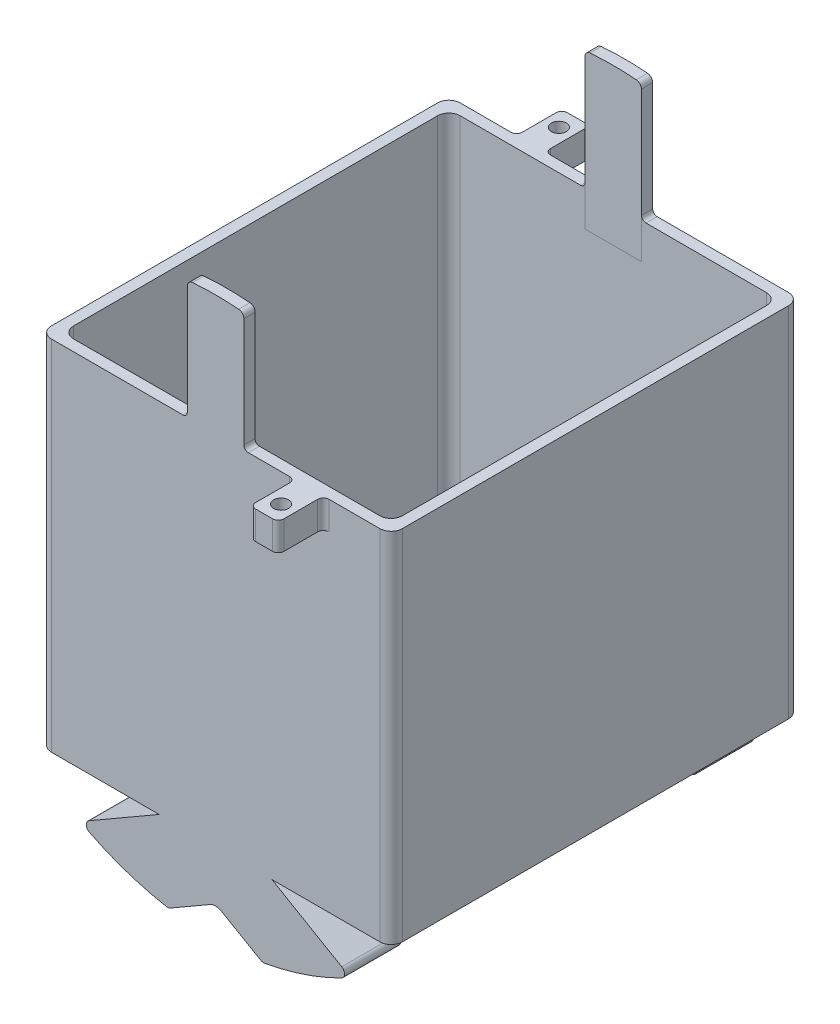
from build123d import *

# Parameters (mm, degrees)
BOSS_EXTRUDE1_DEPTH = 70
CUT_EXTRUDE1_DEPTH  = 79.756
BOSS_EXTRUDE3_DEPTH = 2.54
BOSS_EXTRUDE4_DEPTH = 2.54
BOSS_EXTRUDE5_DEPTH = 12.7
BOSS_EXTRUDE6_START = -2.54
BOSS_EXTRUDE6_DEPTH = 2.54
BOSS_EXTRUDE7_START = -12.7
BOSS_EXTRUDE7_DEPTH = 12.7
BOSS_EXTRUDE8_START = 8
BOSS_EXTRUDE8_DEPTH = 8
SKETCH9_R           = 1.685173155
BOSS_EXTRUDE9_DEPTH = 6.35
FILLET1_R           = 1.27
FILLET3_R           = 1


with BuildPart() as part:
    # Sketch1 → Boss-Extrude1 (new body)
    with BuildSketch(Plane(origin=(0, 0, 0), x_dir=(1, 0, 0), z_dir=(0, 1, 0))):
        with BuildLine():
            Line((-36.96, -46), (36.96, -46))
            ThreePointArc((36.96, -46), (38.756051224, -45.256051224), (39.5, -43.46))
            Line((39.5, -43.46), (39.5, 43.46))
            ThreePointArc((39.5, 43.46), (38.756051224, 45.256051224), (36.96, 46))
            Line((36.96, 46), (-36.96, 46))
            ThreePointArc((-36.96, 46), (-38.756051224, 45.256051224), (-39.5, 43.46))
            Line((-39.5, 43.46), (-39.5, -43.46))
            ThreePointArc((-39.5, -43.46), (-38.756051224, -45.256051224), (-36.96, -46))
        make_face()
    extrude(amount=-BOSS_EXTRUDE1_DEPTH)

    # Sketch2 → Cut-Extrude1 (cut)
    with BuildSketch(Plane(origin=(0, 0, 0), x_dir=(1, 0, 0), z_dir=(0, 1, 0))):
        with BuildLine():
            Line((-34.46, -43.5), (34.46, -43.5))
            ThreePointArc((34.46, -43.5), (36.256051224, -42.756051224), (37, -40.96))
            Line((37, -40.96), (37, 40.96))
            ThreePointArc((37, 40.96), (36.256051224, 42.756051224), (34.46, 43.5))
            Line((34.46, 43.5), (-34.46, 43.5))
            ThreePointArc((-34.46, 43.5), (-36.256051224, 42.756051224), (-37, 40.96))
            Line((-37, 40.96), (-37, -40.96))
            ThreePointArc((-37, -40.96), (-36.256051224, -42.756051224), (-34.46, -43.5))
        make_face()
    extrude(amount=-CUT_EXTRUDE1_DEPTH, mode=Mode.SUBTRACT)

    # Sketch4 → Boss-Extrude3 (add)
    with BuildSketch(Plane.XZ.offset(70)):
        with BuildLine():
            Line((36.96, 46), (-36.96, 46))
            ThreePointArc((-36.96, 46), (-38.756051224, 45.256051224), (-39.5, 43.46))
            Line((-39.5, 43.46), (-39.5, -43.46))
            ThreePointArc((-39.5, -43.46), (-38.756051224, -45.256051224), (-36.96, -46))
            Line((-36.96, -46), (36.96, -46))
            ThreePointArc((36.96, -46), (38.756051224, -45.256051224), (39.5, -43.46))
            Line((39.5, -43.46), (39.5, 43.46))
            ThreePointArc((39.5, 43.46), (38.756051224, 45.256051224), (36.96, 46))
        make_face()
    extrude(amount=BOSS_EXTRUDE3_DEPTH)

    # Sketch5 → Boss-Extrude4 (add)
    with BuildSketch(Plane.XY.offset(46)):
        with BuildLine():
            Line((6.362854251, 0), (6.362854251, 33.604002981))
            ThreePointArc((6.362854251, 33.604002981), (6.027268312, 34.464102023), (5.197861555, 34.869654381))
            ThreePointArc((5.197861555, 34.869654381), (0, 35.084910085), (-5.197861555, 34.869654381))
            ThreePointArc((-5.197861555, 34.869654381), (-6.027268312, 34.464102023), (-6.362854251, 33.604002981))
            Line((-6.362854251, 33.604002981), (-6.362854251, 0))
            Line((-6.362854251, 0), (6.362854251, 0))
        make_face()
    extrude(amount=-BOSS_EXTRUDE4_DEPTH)

    # Sketch5<4> → Boss-Extrude5 (add)
    with BuildSketch(Plane.XY.offset(46)):
        with BuildLine():
            Line((-12.7, -72.54), (-28.453647637, -81.635372704))
            ThreePointArc((-28.453647637, -81.635372704), (-29.088167479, -82.770144478), (-28.392228001, -83.868320535))
            ThreePointArc((-28.392228001, -83.868320535), (-19.920711126, -87.405365539), (-11.024381507, -89.670890825))
            ThreePointArc((-11.024381507, -89.670890825), (-10.582224591, -89.671469352), (-10.166666729, -89.520423878))
            Line((-10.166666729, -89.520423878), (-1.270072648, -84.383972891))
            ThreePointArc((-1.270072648, -84.383972891), (-9.734e-06, -84.043677417), (1.270036321, -84.384035808))
            Line((1.270036321, -84.384035808), (10.165723413, -89.520550737))
            ThreePointArc((10.165723413, -89.520550737), (10.581295609, -89.671620625), (11.023474349, -89.671052407))
            ThreePointArc((11.023474349, -89.671052407), (19.880019162, -87.418945228), (28.31647684, -83.906602049))
            ThreePointArc((28.31647684, -83.906602049), (29.01385185, -82.810943696), (28.383639864, -81.675324049))
            Line((28.383639864, -81.675324049), (12.7, -72.54))
            Line((12.7, -72.54), (-12.7, -72.54))
        make_face()
    extrude(amount=-BOSS_EXTRUDE5_DEPTH)

    # Sketch6 → Boss-Extrude6 (add)
    with BuildSketch(Plane(origin=(0, 0, -46), x_dir=(-1, 0, 0), z_dir=(0, 0, -1)).offset(BOSS_EXTRUDE6_START)):
        with BuildLine():
            Line((-6.362854251, 0), (-6.362854251, 33.604002981))
            ThreePointArc((-6.362854251, 33.604002981), (-6.027268312, 34.464102023), (-5.197861555, 34.869654381))
            ThreePointArc((-5.197861555, 34.869654381), (0, 35.084910085), (5.197861555, 34.869654381))
            ThreePointArc((5.197861555, 34.869654381), (6.027268312, 34.464102023), (6.362854251, 33.604002981))
            Line((6.362854251, 33.604002981), (6.362854251, 0))
            Line((6.362854251, 0), (-6.362854251, 0))
        make_face()
    extrude(amount=BOSS_EXTRUDE6_DEPTH)

    # Sketch6<3> → Boss-Extrude7 (add)
    with BuildSketch(Plane(origin=(0, 0, -46), x_dir=(-1, 0, 0), z_dir=(0, 0, -1)).offset(BOSS_EXTRUDE7_START)):
        with BuildLine():
            Line((-12.7, -72.54), (12.7, -72.54))
            Line((12.7, -72.54), (28.453647637, -81.635372704))
            ThreePointArc((28.453647637, -81.635372704), (29.088167479, -82.770144478), (28.392228001, -83.868320535))
            ThreePointArc((28.392228001, -83.868320535), (19.920711126, -87.405365539), (11.024381507, -89.670890825))
            ThreePointArc((11.024381507, -89.670890825), (10.582224591, -89.671469352), (10.166666729, -89.520423878))
            Line((10.166666729, -89.520423878), (1.270072648, -84.383972891))
            ThreePointArc((1.270072648, -84.383972891), (9.734e-06, -84.043677417), (-1.270036321, -84.384035808))
            Line((-1.270036321, -84.384035808), (-10.165723413, -89.520550737))
            ThreePointArc((-10.165723413, -89.520550737), (-10.581295609, -89.671620625), (-11.023474349, -89.671052407))
            ThreePointArc((-11.023474349, -89.671052407), (-19.880019162, -87.418945228), (-28.31647684, -83.906602049))
            ThreePointArc((-28.31647684, -83.906602049), (-29.01385185, -82.810943696), (-28.383639864, -81.675324049))
            Line((-28.383639864, -81.675324049), (-12.7, -72.54))
        make_face()
    extrude(amount=BOSS_EXTRUDE7_DEPTH)

    # Sketch8 → Boss-Extrude8 (add)
    with BuildSketch(Plane(origin=(0, 0, 0), x_dir=(1, 0, 0), z_dir=(0, 1, 0)).offset(BOSS_EXTRUDE8_START)):
        with BuildLine():
            Line((6.362854251, -43.5), (6.362854251, -46))
            Line((6.362854251, -46), (36.96, -46))
            ThreePointArc((36.96, -46), (38.756051224, -45.256051224), (39.5, -43.46))
            Line((39.5, -43.46), (39.5, 43.46))
            ThreePointArc((39.5, 43.46), (38.756051224, 45.256051224), (36.96, 46))
            Line((36.96, 46), (6.362854251, 46))
            Line((6.362854251, 46), (6.362854251, 43.5))
            Line((6.362854251, 43.5), (34.46, 43.5))
            ThreePointArc((34.46, 43.5), (36.256051224, 42.756051224), (37, 40.96))
            Line((37, 40.96), (37, -40.96))
            ThreePointArc((37, -40.96), (36.257110645, -42.757110645), (34.46, -43.5))
            Line((34.46, -43.5), (6.362854251, -43.5))
        make_face()
        with BuildLine():
            Line((-37, -40.96), (-37, 40.96))
            ThreePointArc((-37, 40.96), (-36.256051224, 42.756051224), (-34.46, 43.5))
            Line((-34.46, 43.5), (-6.362854251, 43.5))
            Line((-6.362854251, 43.5), (-6.362854251, 46))
            Line((-6.362854251, 46), (-36.96, 46))
            ThreePointArc((-36.96, 46), (-38.756051224, 45.256051224), (-39.5, 43.46))
            Line((-39.5, 43.46), (-39.5, -43.46))
            ThreePointArc((-39.5, -43.46), (-38.756051224, -45.256051224), (-36.96, -46))
            Line((-36.96, -46), (-6.362854251, -46))
            Line((-6.362854251, -46), (-6.362854251, -43.46))
            Line((-6.362854251, -43.46), (-34.46, -43.5))
            ThreePointArc((-34.46, -43.5), (-36.257110645, -42.757110645), (-37, -40.96))
        make_face()
    extrude(amount=-BOSS_EXTRUDE8_DEPTH)

    # Sketch9 → Boss-Extrude9 (add)
    # profile 1 of 2: a face of its own
    with BuildSketch(Plane(origin=(0, 8, 0), x_dir=(1, 0, 0), z_dir=(0, 1, 0))):
        with BuildLine():
            Line((-24.26, 46), (-17.91, 46))
            Line((-17.91, 46), (-17.91, 54.89))
            ThreePointArc((-17.91, 54.89), (-18.281974388, 55.788025612), (-19.18, 56.16))
            Line((-19.18, 56.16), (-22.99, 56.16))
            ThreePointArc((-22.99, 56.16), (-23.888025612, 55.788025612), (-24.26, 54.89))
            Line((-24.26, 54.89), (-24.26, 46))
        make_face()
        with Locations((-21.085, 52.35)):
            Circle(SKETCH9_R, mode=Mode.SUBTRACT)
    # profile 2 of 2: a face of its own
    with BuildSketch(Plane(origin=(0, 8, 0), x_dir=(1, 0, 0), z_dir=(0, 1, 0))):
        with BuildLine():
            Line((24.26, -46), (17.91, -46))
            Line((17.91, -46), (17.91, -54.89))
            ThreePointArc((17.91, -54.89), (18.281974388, -55.788025612), (19.18, -56.16))
            Line((19.18, -56.16), (22.99, -56.16))
            ThreePointArc((22.99, -56.16), (23.888025612, -55.788025612), (24.26, -54.89))
            Line((24.26, -54.89), (24.26, -46))
        make_face()
        with Locations((21.085, -52.35)):
            Circle(SKETCH9_R, mode=Mode.SUBTRACT)
    extrude(amount=-BOSS_EXTRUDE9_DEPTH)

    # Fillet1
    fillet1_edges = [part.edges().sort_by_distance(p)[0] for p in [
        (-24.26, 4.825, -46),
        (-17.91, 4.825, -46),
        (17.91, 4.825, 46),
        (24.26, 4.825, 46),
    ]]
    fillet(fillet1_edges, radius=FILLET1_R)

    # Fillet3
    fillet3_edges = [part.edges().sort_by_distance(p)[0] for p in [
        (-6.362854251, 8, 44.73),
        (6.362854251, 8, 44.75),
        (6.362854251, 8, -44.75),
        (-6.362854251, 8, -44.75),
    ]]
    fillet(fillet3_edges, radius=FILLET3_R)


solid = part.part
